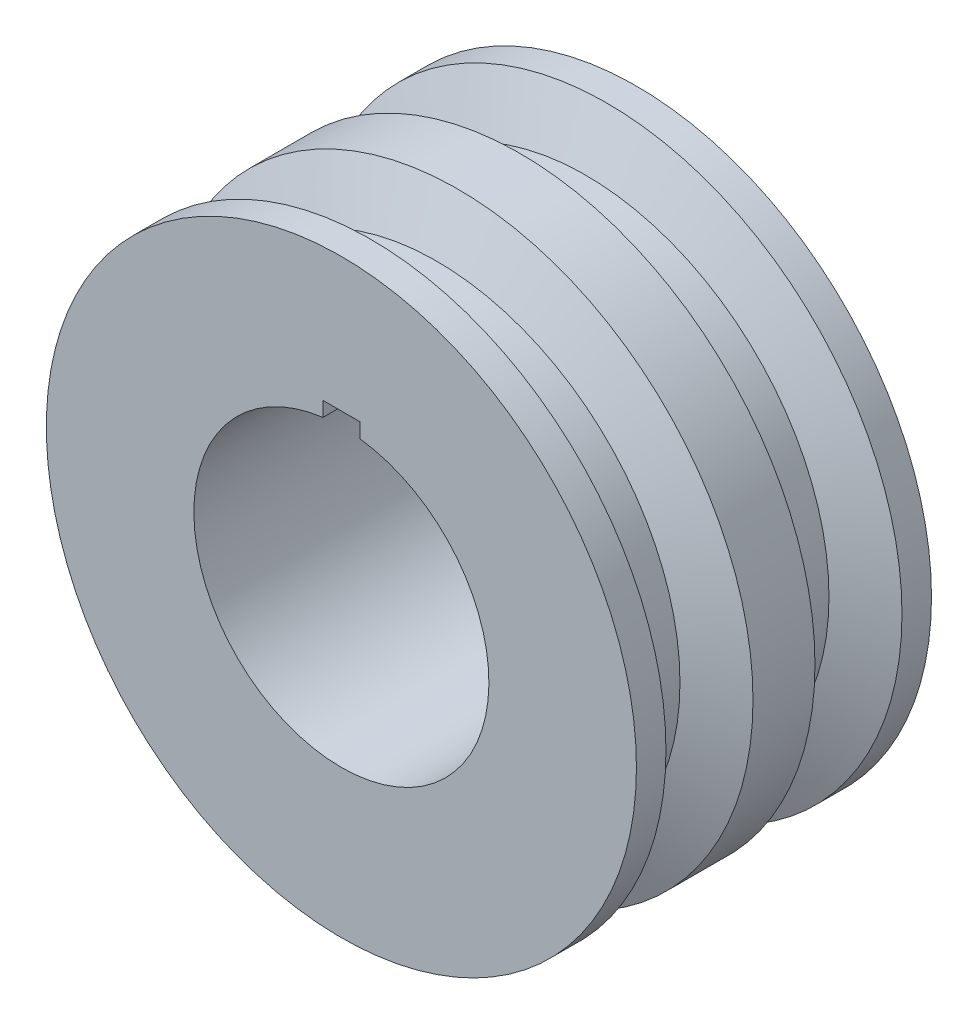
from build123d import *

# Parameters (mm, degrees)
SZKIC1_R                    = 40
DODANIE_WYCI_GNI_CIE1_DEPTH = 40


# Read off the part's stored shape, not the designer's step: Wycięcie-obrót-cienka ścianka1
with BuildPart() as part:
    # Szkic1 → Dodanie-wyciągnięcie1 (new body)
    with BuildSketch(Plane.XY):
        Circle(SZKIC1_R)
        with BuildLine():
            Line((-2.5, 19.843134833), (-2.5, 21.843134833))
            Line((-2.5, 21.843134833), (2.5, 21.843134833))
            Line((2.5, 21.843134833), (2.5, 19.843134833))
            ThreePointArc((2.5, 19.843134833), (0, -20), (-2.5, 19.843134833))
        make_face(mode=Mode.SUBTRACT)
    extrude(amount=DODANIE_WYCI_GNI_CIE1_DEPTH)

    # Wycięcie-obrót-cienka ścianka1 outline → Wycięcie-obrót-cienka ścianka1 (revolve, cut)
    with BuildSketch(Plane.XZ):
        Polygon((40, 15.798989873), (33, 12.899494937), (33, 6.899494937), (40, 4), align=None)
        Polygon((33, 27.100505063), (40, 24.201010127), (40, 36), (33, 33.100505063), align=None)
    revolve(axis=Axis((0, 0, 0), (0, 0, 1)), mode=Mode.SUBTRACT)


solid = part.part
